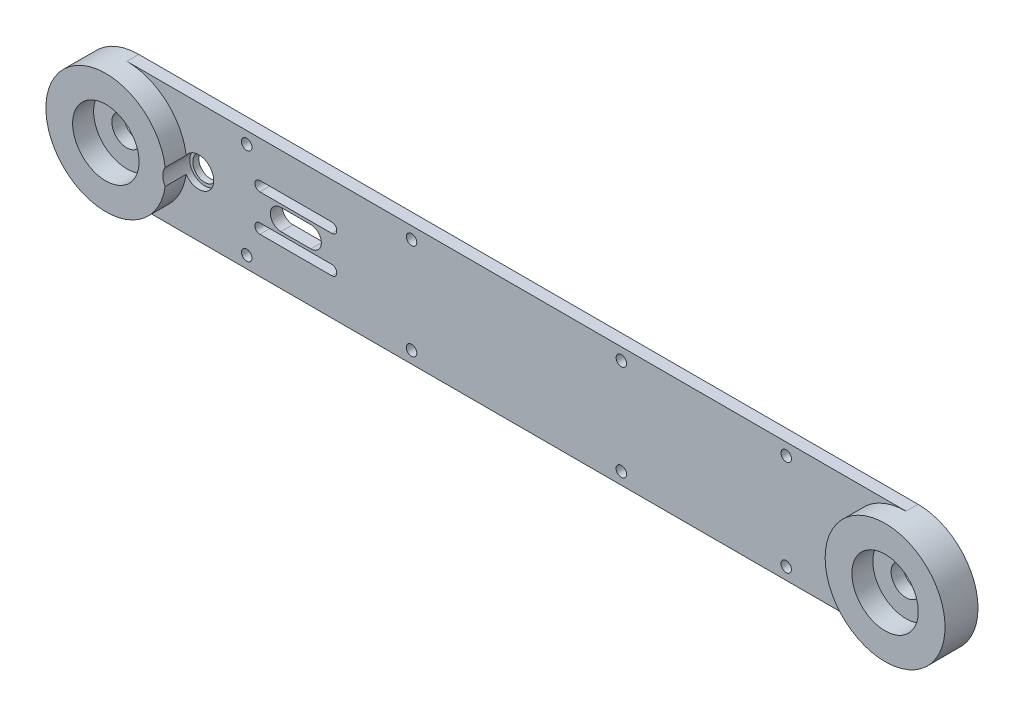
from build123d import *

# Parameters (mm, degrees)
AUFSATZ_LINEAR_AUSTRAGEN1_DEPTH      = 4
SKIZZE2_R                            = 20
SKIZZE2_R_2                          = 11.075
AUFSATZ_LINEAR_AUSTRAGEN2_DEPTH      = 7
SKIZZE3_R                            = 5
SCHNITT_LINEAR_AUSTRAGEN1_DEPTH      = 152.489273548
SKIZZE4_R                            = 1.75
SCHNITT_LINEAR_AUSTRAGEN2_DEPTH      = 152.489273548
SKIZZE5_R                            = 4
SCHNITT_LINEAR_AUSTRAGEN3_DEPTH      = 152.726728034
SCHNITT_LINEAR_AUSTRAGEN4_DEPTH      = 152.489273548
SCHNITT_LINEAR_AUSTRAGEN4_DEPTH_BACK = 2
SKIZZE6_R                            = 5
SCHNITT_LINEAR_AUSTRAGEN5_DEPTH      = 152.726728034


with BuildPart() as part:
    # Skizze1 → Aufsatz-Linear austragen1 (new body)
    with BuildSketch(Plane.XY):
        with BuildLine():
            Line((-130, -20), (130, -20))
            ThreePointArc((130, -20), (150, 0), (130, 20))
            Line((130, 20), (-130, 20))
            ThreePointArc((-130, 20), (-150, 0), (-130, -20))
        make_face()
    extrude(amount=AUFSATZ_LINEAR_AUSTRAGEN1_DEPTH)

    # Skizze2 → Aufsatz-Linear austragen2 (add)
    with BuildSketch(Plane.XY.offset(4)):
        with Locations((-130, 0)):
            Circle(SKIZZE2_R)
        with Locations((-130, 0)):
            Circle(SKIZZE2_R_2, mode=Mode.SUBTRACT)
    aufsatz_linear_austragen2 = extrude(amount=AUFSATZ_LINEAR_AUSTRAGEN2_DEPTH)

    # Skizze3 → Schnitt-Linear austragen1 (cut, symmetric)
    with BuildSketch(Plane.XY.offset(4)):
        with Locations((-130, 0)):
            Circle(SKIZZE3_R)
    schnitt_linear_austragen1 = extrude(amount=SCHNITT_LINEAR_AUSTRAGEN1_DEPTH, both=True, mode=Mode.SUBTRACT)

    # Spiegeln1: Aufsatz-Linear austragen2, Schnitt-Linear austragen1 across plane
    add(aufsatz_linear_austragen2.mirror(Plane(origin=(0, 0, 0), x_dir=(0, 0, 1), z_dir=(1, 0, 0))))
    add(schnitt_linear_austragen1.mirror(Plane(origin=(0, 0, 0), x_dir=(0, 0, 1), z_dir=(1, 0, 0))), mode=Mode.SUBTRACT)

    # Skizze4 → Schnitt-Linear austragen2 (cut, through all)
    with BuildSketch(Plane.XY.offset(4)):
        with Locations((-90, 16)):
            Circle(SKIZZE4_R)
        with Locations((-90, -16)):
            Circle(SKIZZE4_R)
        with Locations((90, -16)):
            Circle(SKIZZE4_R)
        with Locations((90, 16)):
            Circle(SKIZZE4_R)
        with Locations((-35, 16)):
            Circle(SKIZZE4_R)
        with Locations((-35, -16)):
            Circle(SKIZZE4_R)
        with Locations((35, -16)):
            Circle(SKIZZE4_R)
        with Locations((35, 16)):
            Circle(SKIZZE4_R)
    extrude(amount=-SCHNITT_LINEAR_AUSTRAGEN2_DEPTH, mode=Mode.SUBTRACT)

    # Skizze5 → Schnitt-Linear austragen3 (cut, through all)
    with BuildSketch(Plane(origin=(0, 0, 0), x_dir=(-1, 0, 0), z_dir=(0, 0, -1))):
        with Locations((106, 0)):
            Circle(SKIZZE5_R)
    extrude(amount=-SCHNITT_LINEAR_AUSTRAGEN3_DEPTH, mode=Mode.SUBTRACT)

    # Skizze6 → Schnitt-Linear austragen4 (cut, two sides: drawn at the far end of the back side and taken through both)
    with BuildSketch(Plane.XY.offset(4).offset(-SCHNITT_LINEAR_AUSTRAGEN4_DEPTH_BACK)):
        with Locations((-106, 0)):
            Circle(SKIZZE6_R)
    extrude(amount=SCHNITT_LINEAR_AUSTRAGEN4_DEPTH + SCHNITT_LINEAR_AUSTRAGEN4_DEPTH_BACK, mode=Mode.SUBTRACT)

    # Skizze7 → Schnitt-Linear austragen5 (cut, through all)
    with BuildSketch(Plane(origin=(0, 0, 0), x_dir=(-1, 0, 0), z_dir=(0, 0, -1))):
        with BuildLine():
            Line((68.6, 3.5), (78.6, 3.5))
            ThreePointArc((78.6, 3.5), (82.1, 0), (78.6, -3.5))
            Line((78.6, -3.5), (68.6, -3.5))
            ThreePointArc((68.6, -3.5), (65.1, 0), (68.6, 3.5))
        make_face()
        with BuildLine():
            Line((61.6, 7.77), (85.6, 7.77))
            ThreePointArc((85.6, 7.77), (87.25, 6.12), (85.6, 4.47))
            Line((85.6, 4.47), (61.6, 4.47))
            ThreePointArc((61.6, 4.47), (59.95, 6.12), (61.6, 7.77))
        make_face()
        with BuildLine():
            Line((61.6, -7.77), (85.6, -7.77))
            ThreePointArc((85.6, -7.77), (87.25, -6.12), (85.6, -4.47))
            Line((85.6, -4.47), (61.6, -4.47))
            ThreePointArc((61.6, -4.47), (59.95, -6.12), (61.6, -7.77))
        make_face()
    extrude(amount=-SCHNITT_LINEAR_AUSTRAGEN5_DEPTH, mode=Mode.SUBTRACT)


solid = part.part
